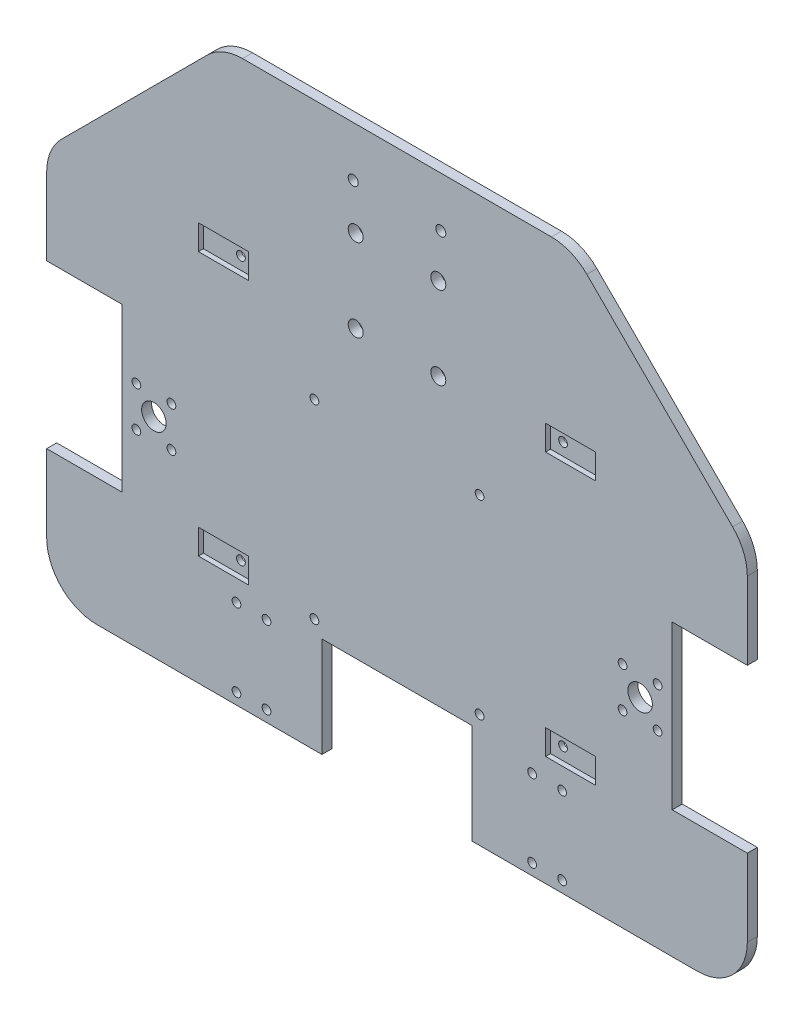
from build123d import *

# Parameters (mm, degrees)
EXTRUDE_1_DEPTH      = 4
L298N_R              = 3
CUT_EXTRUDE_5_DEPTH  = 10
SKETCH_581_R         = 1.75
CUT_EXTRUDE_7_DEPTH  = 10
SKETCH_1384_W        = 30
SKETCH_1384_H        = 65
CUT_EXTRUDE_8_DEPTH  = 10
SKETCH_4052_R        = 2
CUT_EXTRUDE_10_DEPTH = 10
SKETCH_2212_R        = 1.75
SKETCH_2212_R_2      = 4.9
CUT_EXTRUDE_3_DEPTH  = 10
SKETCH_11_W          = 20
SKETCH_11_H          = 10
SKETCH_11_R          = 1.75
CUT_EXTRUDE_11_DEPTH = 2
SKETCH_12_W          = 60
SKETCH_12_H          = 40
CUT_EXTRUDE_12_DEPTH = 10
SKETCH_11_3_R        = 1.75
CUT_EXTRUDE_13_DEPTH = 10
SKETCH_13_R          = 1.75
CUT_EXTRUDE_14_DEPTH = 379.008231757


with BuildPart() as part:
    # 草图3 → 凸台-拉伸1 (new body)
    with BuildSketch(Plane.XY):
        with BuildLine():
            Line((73.505746565, 259.089488009), (196.937204075, 259.089488009))
            ThreePointArc((196.937204075, 259.089488009), (204.590872722, 257.56707866), (211.079339699, 253.231623633))
            Line((211.079339699, 253.231623633), (269.363610946, 194.947352386))
            ThreePointArc((269.363610946, 194.947352386), (273.699065973, 188.458885409), (275.221475323, 180.805216762))
            Line((275.221475323, 180.805216762), (275.221475323, 54.089488009))
            ThreePointArc((275.221475323, 54.089488009), (269.363610946, 39.947352386), (255.221475323, 34.089488009))
            Line((255.221475323, 34.089488009), (15.221475318, 34.089488009))
            ThreePointArc((15.221475318, 34.089488009), (1.079339694, 39.947352386), (-4.778524682, 54.089488009))
            Line((-4.778524682, 54.089488009), (-4.778524682, 180.805216762))
            ThreePointArc((-4.778524682, 180.805216762), (-3.256115333, 188.458885409), (1.079339694, 194.947352386))
            Line((1.079339694, 194.947352386), (59.363610941, 253.231623633))
            ThreePointArc((59.363610941, 253.231623633), (65.852077918, 257.56707866), (73.505746565, 259.089488009))
        make_face()
    extrude(amount=EXTRUDE_1_DEPTH)

    # L298N → 切除-拉伸5 (cut)
    with BuildSketch(Plane.XY):
        with Locations((118.72147532, 188.268420197)):
            Circle(L298N_R)
        with Locations((118.72147532, 221.268420197)):
            Circle(L298N_R)
        with Locations((151.72147532, 221.268420197)):
            Circle(L298N_R)
        with Locations((151.72147532, 188.268420197)):
            Circle(L298N_R)
    extrude(amount=CUT_EXTRUDE_5_DEPTH, mode=Mode.SUBTRACT)

    # Sketch 581 → 切除-拉伸7 (cut)
    with BuildSketch(Plane.XY):
        with Locations((168.22147532, 155.447352386)):
            Circle(SKETCH_581_R)
        with Locations((168.22147532, 79.447352386)):
            Circle(SKETCH_581_R)
        with Locations((102.22147532, 79.447352386)):
            Circle(SKETCH_581_R)
        with Locations((102.22147532, 155.447352386)):
            Circle(SKETCH_581_R)
    extrude(amount=CUT_EXTRUDE_7_DEPTH, mode=Mode.SUBTRACT)

    # Sketch 1384 → 切除-拉伸8 (cut)
    with BuildSketch(Plane.XY.offset(4)):
        with Locations((260.221475323, 117.447352386)):
            Rectangle(SKETCH_1384_W, SKETCH_1384_H)
        with Locations((10.221475318, 117.447352386)):
            Rectangle(SKETCH_1384_W, SKETCH_1384_H)
    extrude(amount=-CUT_EXTRUDE_8_DEPTH, mode=Mode.SUBTRACT)

    # Sketch 4052 → 切除-拉伸10 (cut)
    with BuildSketch(Plane.XY):
        with Locations((152.72147532, 239.089488009)):
            Circle(SKETCH_4052_R)
        with Locations((117.72147532, 239.089488009)):
            Circle(SKETCH_4052_R)
    extrude(amount=CUT_EXTRUDE_10_DEPTH, mode=Mode.SUBTRACT)

    # Sketch 2212 → 切除-拉伸3 (cut)
    with BuildSketch(Plane.XY):
        with Locations((225.371475323, 109.447352386)):
            Circle(SKETCH_2212_R)
        with Locations((239.371475323, 125.447352386)):
            Circle(SKETCH_2212_R)
        with Locations((232.371475323, 117.447352386)):
            Circle(SKETCH_2212_R_2)
        with Locations((225.371475323, 125.447352386)):
            Circle(SKETCH_2212_R)
        with Locations((239.371475323, 109.447352386)):
            Circle(SKETCH_2212_R)
        with Locations((31.071475318, 109.447352386)):
            Circle(SKETCH_2212_R)
        with Locations((45.071475318, 125.447352386)):
            Circle(SKETCH_2212_R)
        with Locations((38.071475318, 117.447352386)):
            Circle(SKETCH_2212_R_2)
        with Locations((31.071475318, 125.447352386)):
            Circle(SKETCH_2212_R)
        with Locations((45.071475318, 109.447352386)):
            Circle(SKETCH_2212_R)
    extrude(amount=CUT_EXTRUDE_3_DEPTH, mode=Mode.SUBTRACT)

    # 草图11 → 切除-拉伸11 (cut)
    # profile 1 of 4: a face of its own
    with BuildSketch(Plane.XY.offset(4)):
        with Locations((65.852077918, 188.458885409)):
            Rectangle(SKETCH_11_W, SKETCH_11_H)
        with Locations((70.852077918, 188.458885409)):
            Circle(SKETCH_11_R, mode=Mode.SUBTRACT)
    # profile 2 of 4: a face of its own
    with BuildSketch(Plane.XY.offset(4)):
        with Locations((65.852077918, 83.089488009)):
            Rectangle(SKETCH_11_W, SKETCH_11_H)
        with Locations((70.852077918, 83.089488009)):
            Circle(SKETCH_11_R, mode=Mode.SUBTRACT)
    # profile 3 of 4: a face of its own
    with BuildSketch(Plane.XY.offset(4)):
        with Locations((204.590872722, 83.089488009)):
            Rectangle(SKETCH_11_W, SKETCH_11_H)
    # profile 4 of 4: a face of its own
    with BuildSketch(Plane.XY.offset(4)):
        with Locations((204.590872722, 188.458885409)):
            Rectangle(SKETCH_11_W, SKETCH_11_H)
    extrude(amount=-CUT_EXTRUDE_11_DEPTH, mode=Mode.SUBTRACT)

    # 草图12 → 切除-拉伸12 (cut)
    with BuildSketch(Plane.XY.offset(4)):
        with Locations((135.22147532, 54.089488009)):
            Rectangle(SKETCH_12_W, SKETCH_12_H)
    extrude(amount=-CUT_EXTRUDE_12_DEPTH, mode=Mode.SUBTRACT)

    # 草图11<3> → 切除-拉伸13 (cut)
    with BuildSketch(Plane.XY.offset(4)):
        with Locations((70.852077918, 83.089488009)):
            Circle(SKETCH_11_3_R)
        with Locations((70.852077918, 188.458885409)):
            Circle(SKETCH_11_3_R)
        with Locations((199.590872722, 83.089488009)):
            Circle(SKETCH_11_3_R)
        with Locations((199.590872722, 188.458885409)):
            Circle(SKETCH_11_3_R)
    extrude(amount=-CUT_EXTRUDE_13_DEPTH, mode=Mode.SUBTRACT)

    # 草图13 → 切除-拉伸14 (cut, through all)
    with BuildSketch(Plane.XY.offset(4)):
        with Locations((83.07147532, 38.589488009)):
            Circle(SKETCH_13_R)
        with Locations((71.07147532, 38.589488009)):
            Circle(SKETCH_13_R)
        with Locations((71.07147532, 69.589488009)):
            Circle(SKETCH_13_R)
        with Locations((83.07147532, 69.589488009)):
            Circle(SKETCH_13_R)
        with Locations((189.22147532, 69.589488009)):
            Circle(SKETCH_13_R)
        with Locations((201.22147532, 69.589488009)):
            Circle(SKETCH_13_R)
        with Locations((201.22147532, 38.589488009)):
            Circle(SKETCH_13_R)
        with Locations((189.22147532, 38.589488009)):
            Circle(SKETCH_13_R)
    extrude(amount=-CUT_EXTRUDE_14_DEPTH, mode=Mode.SUBTRACT)


solid = part.part
